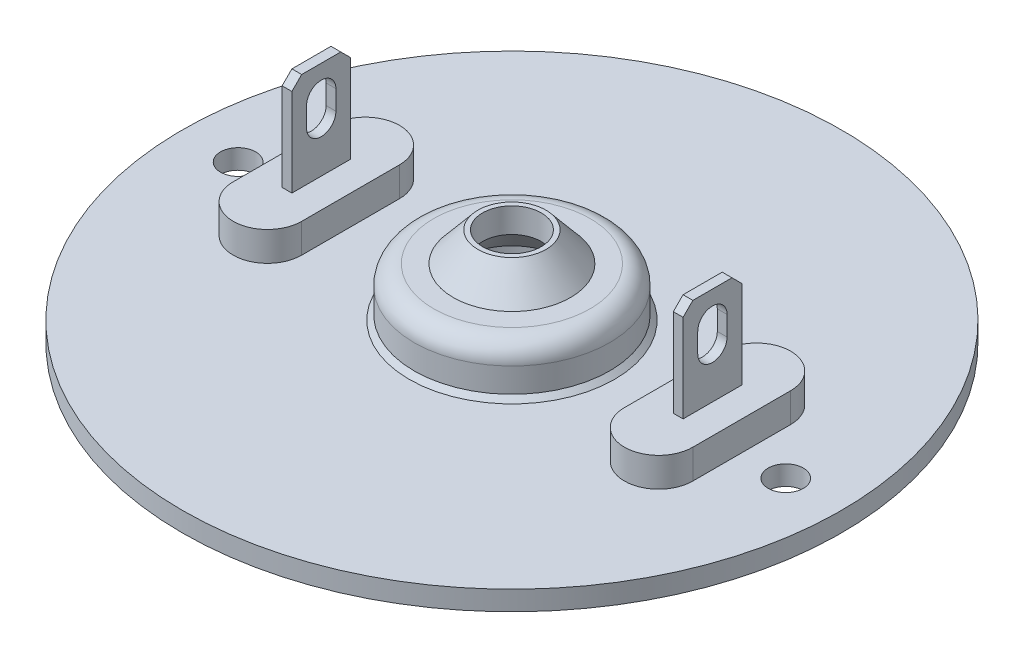
from build123d import *

# Parameters (mm, degrees)
SKETCH1_R                = 16.85
BOSS_EXTRUDE1_DEPTH      = 1
SKETCH2_R                = 5
BOSS_EXTRUDE2_DEPTH      = 2.5
SKETCH3_R                = 3
BOSS_EXTRUDE3_DEPTH      = 1.5
CHAMFER1_SIZE2           = 1.258649447
CHAMFER1_SIZE            = 1.5
FILLET1_R                = 1
CHAMFER3_SIZE            = 0.25
CUT_EXTRUDE2_REACH       = 26.163
SKETCH5_R                = 0.9
CUT_EXTRUDE1_REACH       = 26.348
SKETCH4_R                = 1.5
BOSS_EXTRUDE4_DEPTH      = 1.5
SKETCH7_W                = 0.5
SKETCH7_H                = 3
BOSS_EXTRUDE5_DEPTH      = 5
CHAMFER4_SIZE            = 0.5
CUT_EXTRUDE3_REACH       = 34.781
CHAMFER4_OF_MIRROR1_SIZE = 0.5


# Read off the part's stored shape, not the designer's step: Shell2
with BuildPart() as part:
    # Sketch1 → Boss-Extrude1 (new body)
    with BuildSketch(Plane(origin=(0, 0, 0), x_dir=(1, 0, 0), z_dir=(0, 1, 0))):
        with Locations(Location((0, 0, 0), (0, 0, 270))):
            Circle(SKETCH1_R)
    extrude(amount=BOSS_EXTRUDE1_DEPTH)

    # Sketch2 → Boss-Extrude2 (add)
    with BuildSketch(Plane(origin=(0, 1, 0), x_dir=(1, 0, 0), z_dir=(0, 1, 0))):
        with Locations(Location((0, 0, 0), (0, 0, 270))):
            Circle(SKETCH2_R)
    extrude(amount=BOSS_EXTRUDE2_DEPTH)

    # Sketch3 → Boss-Extrude3 (add)
    with BuildSketch(Plane(origin=(0, 3.5, 0), x_dir=(1, 0, 0), z_dir=(0, 1, 0))):
        with Locations(Location((0, 0, 0), (0, 0, 270))):
            Circle(SKETCH3_R)
    extrude(amount=BOSS_EXTRUDE3_DEPTH)

    # Chamfer1
    chamfer1_edges = [part.edges().sort_by_distance(p)[0] for p in [
        (0, 5, -3),
    ]]
    chamfer1_side = [part.faces().sort_by_distance(p)[0] for p in [
        (0, 4.974827011, -3),
    ]]
    chamfer(chamfer1_edges, length=CHAMFER1_SIZE - 0.0001, length2=CHAMFER1_SIZE2 - 0.0001, reference=chamfer1_side[0])  # a hair under: the kernel refuses the full size

    # Fillet1
    fillet1_edges = [part.edges().sort_by_distance(p)[0] for p in [
        (0, 3.5, -5),
    ]]
    fillet(fillet1_edges, radius=FILLET1_R)

    # Chamfer3
    chamfer3_edges = [part.edges().sort_by_distance(p)[0] for p in [
        (0, 1, -5),
    ]]
    chamfer(chamfer3_edges, length=CHAMFER3_SIZE)

    # Shell2 outline → Shell2 (revolve, cut)
    with BuildSketch(Plane.XY):
        Polygon((4, 0.835786438), (4, 2.5), (2.533692342, 2.5), (1.275042895, 4), (0, 4), (0, 0), (4.835786438, 0), align=None)
    revolve(axis=Axis((0, 0, 0), (0, 1, 0)), mode=Mode.SUBTRACT)

    # Sketch5 → Cut-Extrude2 (cut, up to next)
    with BuildSketch(Plane(origin=(0, 1, 0), x_dir=(1, 0, 0), z_dir=(0, 1, 0)), mode=Mode.PRIVATE) as cut_extrude2_sk1:
        with Locations(Location((-14, 0, 0), (0, 0, 270))):
            Circle(SKETCH5_R)
    cut_extrude2_tool1 = extrude(cut_extrude2_sk1.sketch, amount=-CUT_EXTRUDE2_REACH, mode=Mode.PRIVATE) & part.part
    cut_extrude2 = cut_extrude2_tool1.solids().sort_by_distance((-14, 1, 0))[0]
    add(cut_extrude2, mode=Mode.SUBTRACT)

    # Sketch4 → Cut-Extrude1 (cut, up to next)
    with BuildSketch(Plane(origin=(0, 5, 0), x_dir=(1, 0, 0), z_dir=(0, 1, 0)), mode=Mode.PRIVATE) as cut_extrude1_sk1:
        with Locations(Location((0, 0, 0), (0, 0, 270))):
            Circle(SKETCH4_R)
    cut_extrude1_tool1 = extrude(cut_extrude1_sk1.sketch, amount=-CUT_EXTRUDE1_REACH, mode=Mode.PRIVATE) & part.part
    add(cut_extrude1_tool1.solids().sort_by_distance((0, 5, 0))[0], mode=Mode.SUBTRACT)

    # Sketch6 → Boss-Extrude4 (add)
    with BuildSketch(Plane(origin=(0, 1, 0), x_dir=(1, 0, 0), z_dir=(0, 1, 0))):
        with BuildLine():
            Line((-11.75, -2.5), (-11.75, 2.5))
            ThreePointArc((-11.75, 2.5), (-10, 4.25), (-8.25, 2.5))
            Line((-8.25, 2.5), (-8.25, -2.5))
            ThreePointArc((-8.25, -2.5), (-10, -4.25), (-11.75, -2.5))
        make_face()
    boss_extrude4 = extrude(amount=BOSS_EXTRUDE4_DEPTH)

    # Sketch7 → Boss-Extrude5 (add)
    with BuildSketch(Plane(origin=(0, 2.5, 0), x_dir=(1, 0, 0), z_dir=(0, 1, 0))):
        with Locations((-10, 0)):
            Rectangle(SKETCH7_W, SKETCH7_H)
    boss_extrude5 = extrude(amount=BOSS_EXTRUDE5_DEPTH)

    # Chamfer4
    chamfer4_edges = [part.edges().sort_by_distance(p)[0] for p in [
        (-10, 7.5, -1.5),
        (-10, 7.5, 1.5),
    ]]
    chamfer(chamfer4_edges, length=CHAMFER4_SIZE)

    # Sketch8 → Cut-Extrude3 (cut, up to next)
    with BuildSketch(Plane.ZY.offset(10.25), mode=Mode.PRIVATE) as cut_extrude3_sk1:
        with BuildLine():
            Line((-0.75, 5), (-0.75, 6))
            ThreePointArc((-0.75, 6), (0, 6.75), (0.75, 6))
            Line((0.75, 6), (0.75, 5))
            ThreePointArc((0.75, 5), (0, 4.25), (-0.75, 5))
        make_face()
    cut_extrude3_tool1 = extrude(cut_extrude3_sk1.sketch, amount=-CUT_EXTRUDE3_REACH, mode=Mode.PRIVATE) & part.part
    cut_extrude3 = cut_extrude3_tool1.solids().sort_by_distance((-10.25, 5.5, 0))[0]
    add(cut_extrude3, mode=Mode.SUBTRACT)

    # Mirror1: Cut-Extrude2, Boss-Extrude4, Boss-Extrude5, Cut-Extrude3 across plane
    add(cut_extrude2.mirror(Plane(origin=(0, 0, 0), x_dir=(0, 0, 1), z_dir=(1, 0, 0))), mode=Mode.SUBTRACT)
    add(boss_extrude4.mirror(Plane(origin=(0, 0, 0), x_dir=(0, 0, 1), z_dir=(1, 0, 0))))
    add(boss_extrude5.mirror(Plane(origin=(0, 0, 0), x_dir=(0, 0, 1), z_dir=(1, 0, 0))))
    add(cut_extrude3.mirror(Plane(origin=(0, 0, 0), x_dir=(0, 0, 1), z_dir=(1, 0, 0))), mode=Mode.SUBTRACT)

    # Chamfer4 of Mirror1
    chamfer4_of_mirror1_edges = [part.edges().sort_by_distance(p)[0] for p in [
        (10, 7.5, -1.5),
        (10, 7.5, 1.5),
    ]]
    chamfer(chamfer4_of_mirror1_edges, length=CHAMFER4_OF_MIRROR1_SIZE)


solid = part.part
